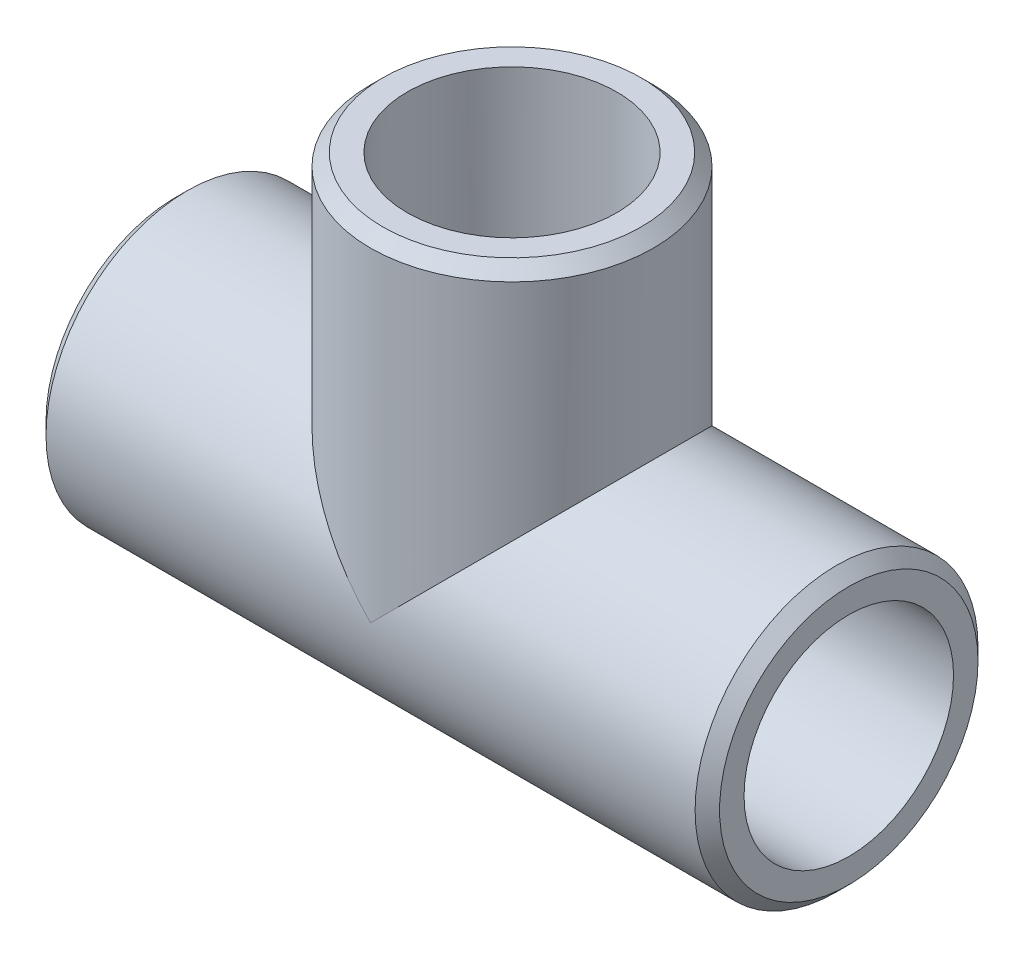
from build123d import *

# Parameters (mm, degrees)
RUNROUTE_R           = 10.668
RUNEXTRUDE_DEPTH     = 25.4
OUTLETROUTE_R        = 10.668
OUTLETEXTRUDE_DEPTH  = 25.4
TEESHELL_START       = -25.4
TEESHELL_OUTLINE_R   = 7.8994
TEESHELL_DEPTH       = 50.8
TEESHELL_START_2     = -1e-07
TEESHELL_2_OUTLINE_R = 7.8994
TEESHELL_2_DEPTH     = 25.4000001
TEECHAMFER_SIZE      = 0.922866667


with BuildPart() as part:
    # RunRoute → RunExtrude (new body)
    with BuildSketch(Plane(origin=(0, 0, 0), x_dir=(0, 0, -1), z_dir=(1, 0, 0))):
        Circle(RUNROUTE_R)
    runextrude = extrude(amount=RUNEXTRUDE_DEPTH)

    # RunExtrudeMirror: RunExtrude across plane
    add(runextrude.mirror(Plane(origin=(0, 0, 0), x_dir=(0, 0, 1), z_dir=(1, 0, 0))))

    # OutletRoute → OutletExtrude (add)
    with BuildSketch(Plane(origin=(0, 0, 0), x_dir=(1, 0, 0), z_dir=(0, 1, 0))):
        with Locations(Location((0, 0, 0), (0, 0, 270))):
            Circle(OUTLETROUTE_R)
    extrude(amount=OUTLETEXTRUDE_DEPTH)

    # TeeShell: read off the stored shape, not the designer's step
    # TeeShell outline → TeeShell (cut)
    with BuildSketch(Plane.YZ.offset(TEESHELL_START)):
        Circle(TEESHELL_OUTLINE_R)
    extrude(amount=TEESHELL_DEPTH, mode=Mode.SUBTRACT)

    # TeeShell 2 outline → TeeShell 2 (cut)
    with BuildSketch(Plane(origin=(0, 0, 0), x_dir=(1, 0, 0), z_dir=(0, 1, 0)).offset(TEESHELL_START_2)):
        Circle(TEESHELL_2_OUTLINE_R)
    extrude(amount=TEESHELL_2_DEPTH, mode=Mode.SUBTRACT)

    # TeeChamfer
    # the kernel refuses this chamfer: 0.922866667 mm, written as the material it takes off along each edge
    with BuildSketch(Plane(origin=(25.4, 0, 0), x_dir=(0, 0, -1), z_dir=(0, -1, 0))) as teechamfer_piece_1:
        Polygon((10.668, -TEECHAMFER_SIZE), (10.668 - TEECHAMFER_SIZE, 0), (10.668, 0), align=None)
    revolve(axis=Axis((25.4, 0, 0), (1, 0, 0)), mode=Mode.SUBTRACT)
    with BuildSketch(Plane(origin=(-25.4, 0, 0), x_dir=(0, 0, -1), z_dir=(0, -1, 0))) as teechamfer_piece_2:
        Polygon((10.668, TEECHAMFER_SIZE), (10.668 - TEECHAMFER_SIZE, 0), (10.668, 0), align=None)
    revolve(axis=Axis((-25.4, 0, 0), (1, 0, 0)), mode=Mode.SUBTRACT)
    with BuildSketch(Plane(origin=(0, 25.4, 0), x_dir=(0, 0, 1), z_dir=(-1, 0, 0))) as teechamfer_piece_3:
        Polygon((10.668, -TEECHAMFER_SIZE), (10.668 - TEECHAMFER_SIZE, 0), (10.668, 0), align=None)
    revolve(axis=Axis((0, 25.4, 0), (0, 1, 0)), mode=Mode.SUBTRACT)


solid = part.part
